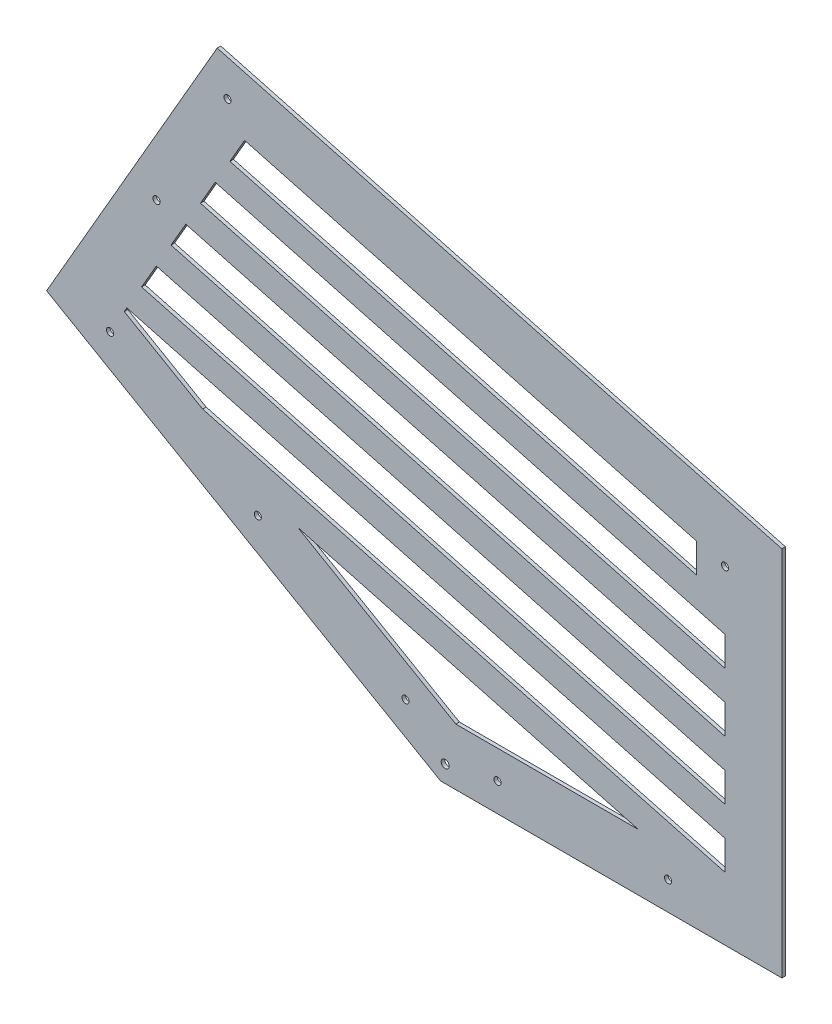
from build123d import *

# Parameters (mm, degrees)
SKETCH_1_R      = 1.7859375
SKETCH_1_R_2    = 1.5875
EXTRUDE_1_DEPTH = 1.5875


with BuildPart() as part:
    # 스케치1 → 보스-돌출1 (new body)
    with BuildSketch(Plane.XY):
        Polygon((0, 0), (152.4, 0), (152.4, 166.011818976), (-99.776362049, 233.582271537), (-175.976362049, 101.6), align=None)
        with Locations((2.041772846, 7.62)):
            Circle(SKETCH_1_R, mode=Mode.SUBTRACT)
        with Locations((101.6, 12.7)):
            Circle(SKETCH_1_R_2, mode=Mode.SUBTRACT)
        with Locations((25.4, 12.7)):
            Circle(SKETCH_1_R_2, mode=Mode.SUBTRACT)
        with Locations((-147.629316793, 99.898522628)):
            Circle(SKETCH_1_R_2, mode=Mode.SUBTRACT)
        with Locations((-81.638181024, 61.798522628)):
            Circle(SKETCH_1_R_2, mode=Mode.SUBTRACT)
        with Locations((-15.647045256, 23.698522628)):
            Circle(SKETCH_1_R_2, mode=Mode.SUBTRACT)
        with Locations((-95.127839421, 216.233748909)):
            Circle(SKETCH_1_R_2, mode=Mode.SUBTRACT)
        with Locations((-126.877839421, 161.241135768)):
            Circle(SKETCH_1_R_2, mode=Mode.SUBTRACT)
        with Locations((127, 146.521713481)):
            Circle(SKETCH_1_R_2, mode=Mode.SUBTRACT)
        Polygon((-87.52436954, 204.003345056), (-94.098373286, 192.616836559), (114.3, 136.776660734), (114.3, 149.924668225), align=None, mode=Mode.SUBTRACT)
        Polygon((-141.279316793, 110.897045256), (-106.301504082, 90.702595672), (127, 28.18964606), (127, 41.337653551), (-140.116399505, 112.911277084), align=None, mode=Mode.SUBTRACT)
        Polygon((6.805909488, 25.4), (88.342068856, 25.4), (-63.806475852, 66.168079684), align=None, mode=Mode.SUBTRACT)
        Polygon((-107.246380777, 169.843819566), (127, 107.077691007), (127, 120.225698498), (-100.672377031, 181.230328063), align=None, mode=Mode.SUBTRACT)
        Polygon((-113.820384523, 158.45731107), (127, 93.929683516), (127, 80.781676025), (-120.394388268, 147.070802573), align=None, mode=Mode.SUBTRACT)
        Polygon((-133.542395759, 124.29778558), (127, 54.485661042), (127, 67.633668534), (-126.968392014, 135.684294077), align=None, mode=Mode.SUBTRACT)
    extrude(amount=EXTRUDE_1_DEPTH)


solid = part.part
